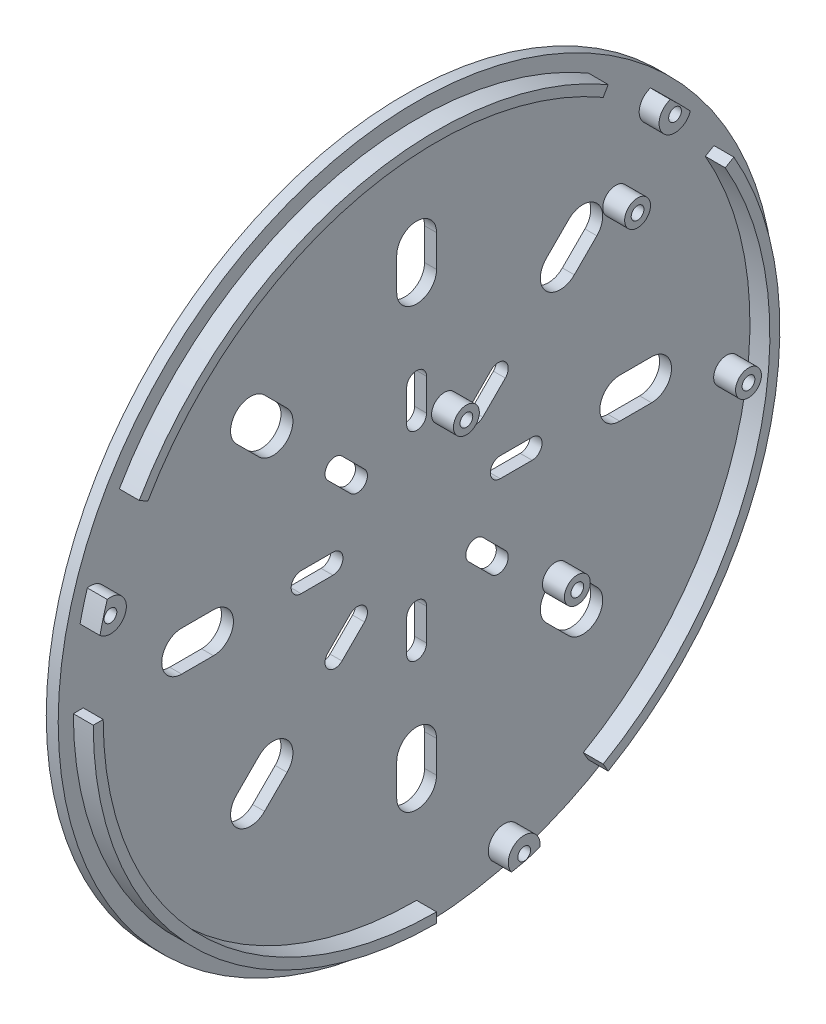
from build123d import *

# Parameters (mm, degrees)
SKETCH1_R               = 90
BOSS_EXTRUDE1_DEPTH     = 3
BOSS_EXTRUDE2_OUTLINE_R = 1.6
BOSS_EXTRUDE2_DEPTH     = 5
CUT_EXTRUDE1_DEPTH      = 128.377392174
CUT_EXTRUDE1_DEPTH_BACK = 128.377392174
SKETCH3_R               = 1.6
CUT_EXTRUDE2_DEPTH      = 128.530388683
CUT_EXTRUDE2_DEPTH_BACK = 2
SKETCH4_R               = 3.6
SKETCH4_R_2             = 1.6
BOSS_EXTRUDE3_DEPTH     = 5
SKETCH7_R               = 3.25
SKETCH7_R_2             = 1.6
BOSS_EXTRUDE4_DEPTH     = 5.5


# Read off the part's stored shape, not the designer's step: Boss-Extrude2
with BuildPart() as part:
    # Sketch1 → Boss-Extrude1 (new body)
    with BuildSketch(Plane(origin=(0, 0, 0), x_dir=(0, 0, -1), z_dir=(1, 0, 0))):
        Circle(SKETCH1_R)
        with BuildLine():
            Line((5, -51), (5, -59))
            ThreePointArc((5, -59), (0, -64), (-5, -59))
            Line((-5, -59), (-5, -51))
            ThreePointArc((-5, -51), (0, -46), (5, -51))
        make_face(mode=Mode.SUBTRACT)
        with BuildLine():
            Line((2.5, -21), (2.5, -29))
            ThreePointArc((2.5, -29), (0, -31.5), (-2.5, -29))
            Line((-2.5, -29), (-2.5, -21))
            ThreePointArc((-2.5, -21), (0, -18.5), (2.5, -21))
        make_face(mode=Mode.SUBTRACT)
        with BuildLine():
            Line((-32.526911935, -39.597979746), (-38.183766184, -45.254833996))
            ThreePointArc((-38.183766184, -45.254833996), (-45.254833996, -45.254833996), (-45.254833996, -38.183766184))
            Line((-45.254833996, -38.183766184), (-39.597979746, -32.526911935))
            ThreePointArc((-39.597979746, -32.526911935), (-32.526911935, -32.526911935), (-32.526911935, -39.597979746))
        make_face(mode=Mode.SUBTRACT)
        with BuildLine():
            Line((-13.081475452, -16.617009358), (-18.738329701, -22.273863607))
            ThreePointArc((-18.738329701, -22.273863607), (-22.273863607, -22.273863607), (-22.273863607, -18.738329701))
            Line((-22.273863607, -18.738329701), (-16.617009358, -13.081475452))
            ThreePointArc((-16.617009358, -13.081475452), (-13.081475452, -13.081475452), (-13.081475452, -16.617009358))
        make_face(mode=Mode.SUBTRACT)
        with BuildLine():
            Line((-51, -5), (-59, -5))
            ThreePointArc((-59, -5), (-64, 0), (-59, 5))
            Line((-59, 5), (-51, 5))
            ThreePointArc((-51, 5), (-46, 0), (-51, -5))
        make_face(mode=Mode.SUBTRACT)
        with BuildLine():
            Line((-21, -2.5), (-29, -2.5))
            ThreePointArc((-29, -2.5), (-31.5, 0), (-29, 2.5))
            Line((-29, 2.5), (-21, 2.5))
            ThreePointArc((-21, 2.5), (-18.5, 0), (-21, -2.5))
        make_face(mode=Mode.SUBTRACT)
        with BuildLine():
            Line((-39.597979746, 32.526911935), (-45.254833996, 38.183766184))
            ThreePointArc((-45.254833996, 38.183766184), (-45.254833996, 45.254833996), (-38.183766184, 45.254833996))
            Line((-38.183766184, 45.254833996), (-32.526911935, 39.597979746))
            ThreePointArc((-32.526911935, 39.597979746), (-32.526911935, 32.526911935), (-39.597979746, 32.526911935))
        make_face(mode=Mode.SUBTRACT)
        with BuildLine():
            Line((-16.617009358, 13.081475452), (-22.273863607, 18.738329701))
            ThreePointArc((-22.273863607, 18.738329701), (-22.273863607, 22.273863607), (-18.738329701, 22.273863607))
            Line((-18.738329701, 22.273863607), (-13.081475452, 16.617009358))
            ThreePointArc((-13.081475452, 16.617009358), (-13.081475452, 13.081475452), (-16.617009358, 13.081475452))
        make_face(mode=Mode.SUBTRACT)
        with BuildLine():
            Line((-5, 51), (-5, 59))
            ThreePointArc((-5, 59), (0, 64), (5, 59))
            Line((5, 59), (5, 51))
            ThreePointArc((5, 51), (0, 46), (-5, 51))
        make_face(mode=Mode.SUBTRACT)
        with BuildLine():
            Line((-2.5, 21), (-2.5, 29))
            ThreePointArc((-2.5, 29), (0, 31.5), (2.5, 29))
            Line((2.5, 29), (2.5, 21))
            ThreePointArc((2.5, 21), (0, 18.5), (-2.5, 21))
        make_face(mode=Mode.SUBTRACT)
        with BuildLine():
            Line((32.526911935, 39.597979746), (38.183766184, 45.254833996))
            ThreePointArc((38.183766184, 45.254833996), (45.254833996, 45.254833996), (45.254833996, 38.183766184))
            Line((45.254833996, 38.183766184), (39.597979746, 32.526911935))
            ThreePointArc((39.597979746, 32.526911935), (32.526911935, 32.526911935), (32.526911935, 39.597979746))
        make_face(mode=Mode.SUBTRACT)
        with BuildLine():
            Line((13.081475452, 16.617009358), (18.738329701, 22.273863607))
            ThreePointArc((18.738329701, 22.273863607), (22.273863607, 22.273863607), (22.273863607, 18.738329701))
            Line((22.273863607, 18.738329701), (16.617009358, 13.081475452))
            ThreePointArc((16.617009358, 13.081475452), (13.081475452, 13.081475452), (13.081475452, 16.617009358))
        make_face(mode=Mode.SUBTRACT)
        with BuildLine():
            Line((51, 5), (59, 5))
            ThreePointArc((59, 5), (64, 0), (59, -5))
            Line((59, -5), (51, -5))
            ThreePointArc((51, -5), (46, 0), (51, 5))
        make_face(mode=Mode.SUBTRACT)
        with BuildLine():
            Line((21, 2.5), (29, 2.5))
            ThreePointArc((29, 2.5), (31.5, 0), (29, -2.5))
            Line((29, -2.5), (21, -2.5))
            ThreePointArc((21, -2.5), (18.5, 0), (21, 2.5))
        make_face(mode=Mode.SUBTRACT)
        with BuildLine():
            Line((39.597979746, -32.526911935), (45.254833996, -38.183766184))
            ThreePointArc((45.254833996, -38.183766184), (45.254833996, -45.254833996), (38.183766184, -45.254833996))
            Line((38.183766184, -45.254833996), (32.526911935, -39.597979746))
            ThreePointArc((32.526911935, -39.597979746), (32.526911935, -32.526911935), (39.597979746, -32.526911935))
        make_face(mode=Mode.SUBTRACT)
        with BuildLine():
            Line((16.617009358, -13.081475452), (22.273863607, -18.738329701))
            ThreePointArc((22.273863607, -18.738329701), (22.273863607, -22.273863607), (18.738329701, -22.273863607))
            Line((18.738329701, -22.273863607), (13.081475452, -16.617009358))
            ThreePointArc((13.081475452, -16.617009358), (13.081475452, -13.081475452), (16.617009358, -13.081475452))
        make_face(mode=Mode.SUBTRACT)
    extrude(amount=BOSS_EXTRUDE1_DEPTH)

    # Boss-Extrude2 outline → Boss-Extrude2 (add)
    # profile 1 of 6: a face of its own
    with BuildSketch(Plane(origin=(3, 0, 0), x_dir=(0, 0, -1), z_dir=(1, 0, 0))):
        with BuildLine():
            ThreePointArc((25.967237713, -82.562734121), (20.964096527, -78.188292965), (18.820512309, -84.478937117))
            add(Edge.make_bspline(
                [(18.820512309, -84.478937117), (22.486577272, -83.865832246), (25.967237713, -82.562734121)],
                knots=[0, 0, 0, 1, 1, 1], degree=2))
        make_face()
        with Locations((22, -82.051828133)):
            Circle(BOSS_EXTRUDE2_OUTLINE_R, mode=Mode.SUBTRACT)
    # profile 2 of 6: a face of its own
    with BuildSketch(Plane(origin=(3, 0, 0), x_dir=(0, 0, -1), z_dir=(1, 0, 0))):
        with BuildLine():
            ThreePointArc((58.709779231, 63.592958122), (57.048561164, 56.942066762), (63.702544859, 58.590854905))
            ThreePointArc((63.702544859, 58.590854905), (61.257240645, 61.142889763), (58.709779231, 63.592958122))
        make_face()
        with Locations((59.879629478, 59.767850228)):
            Circle(BOSS_EXTRUDE2_OUTLINE_R, mode=Mode.SUBTRACT)
    # profile 3 of 6: a face of its own
    with BuildSketch(Plane(origin=(3, 0, 0), x_dir=(0, 0, -1), z_dir=(1, 0, 0))):
        with BuildLine():
            ThreePointArc((-82.683160515, 25.581193623), (-83.671189992, 22.136722102), (-84.515793874, 18.654304753))
            ThreePointArc((-84.515793874, 18.654304753), (-78.012676735, 20.639660383), (-82.683160515, 25.581193623))
        make_face()
        with Locations((-81.879629478, 21.662732462)):
            Circle(BOSS_EXTRUDE2_OUTLINE_R, mode=Mode.SUBTRACT)
    # profile 4 of 6: a face of its own
    with BuildSketch(Plane(origin=(3, 0, 0), x_dir=(0, 0, -1), z_dir=(1, 0, 0))):
        with BuildLine():
            Line((0, -86.2), (0, -83.7))
            ThreePointArc((0, -83.7), (-59.184837585, -59.184837585), (-83.7, 0))
            Line((-83.7, 0), (-86.2, 0))
            ThreePointArc((-86.2, 0), (-60.952604538, -60.952604538), (0, -86.2))
        make_face()
    # profile 5 of 6: a face of its own
    with BuildSketch(Plane(origin=(3, 0, 0), x_dir=(0, 0, -1), z_dir=(1, 0, 0))):
        with BuildLine():
            Line((-74.651389806, 43.1), (-72.486326297, 41.85))
            ThreePointArc((-72.486326297, 41.85), (-21.663154075, 80.84799166), (41.85, 72.486326297))
            Line((41.85, 72.486326297), (43.1, 74.651389806))
            ThreePointArc((43.1, 74.651389806), (-22.310201688, 83.262806226), (-74.651389806, 43.1))
        make_face()
    # profile 6 of 6: a face of its own
    with BuildSketch(Plane(origin=(3, 0, 0), x_dir=(0, 0, -1), z_dir=(1, 0, 0))):
        with BuildLine():
            Line((74.651389806, 43.1), (72.486326297, 41.85))
            ThreePointArc((72.486326297, 41.85), (80.84799166, -21.663154075), (41.85, -72.486326297))
            Line((41.85, -72.486326297), (43.1, -74.651389806))
            ThreePointArc((43.1, -74.651389806), (83.262806226, -22.310201688), (74.651389806, 43.1))
        make_face()
    extrude(amount=BOSS_EXTRUDE2_DEPTH)

    # Sketch3 → Cut-Extrude1 (cut, two sides: drawn at the far end of the back side and taken through both)
    with BuildSketch(Plane(origin=(3, 0, 0), x_dir=(0, 0, -1), z_dir=(1, 0, 0)).offset(-CUT_EXTRUDE1_DEPTH_BACK)):
        with Locations((22, -82.051828133)):
            Circle(SKETCH3_R)
        with Locations((59.879629478, 59.767850228)):
            Circle(SKETCH3_R)
        with Locations((-81.879629478, 21.662732462)):
            Circle(SKETCH3_R)
    extrude(amount=CUT_EXTRUDE1_DEPTH + CUT_EXTRUDE1_DEPTH_BACK, mode=Mode.SUBTRACT)

    # Sketch4 → Cut-Extrude2 (cut, two sides: drawn at the far end of the back side and taken through both)
    # profile 1 of 3: a face of its own
    with BuildSketch(Plane.ZY.offset(-CUT_EXTRUDE2_DEPTH_BACK)):
        with Locations(Location((81.879629478, 21.662732462, 0), (0, 0, 180))):
            Circle(SKETCH4_R)
        with Locations((81.879629478, 21.662732462)):
            Circle(SKETCH4_R_2, mode=Mode.SUBTRACT)
    # profile 2 of 3: a face of its own
    with BuildSketch(Plane.ZY.offset(-CUT_EXTRUDE2_DEPTH_BACK)):
        with Locations(Location((-22, -82.051828133, 0), (0, 0, 180))):
            Circle(SKETCH4_R)
        with Locations((-22, -82.051828133)):
            Circle(SKETCH4_R_2, mode=Mode.SUBTRACT)
    # profile 3 of 3: a face of its own
    with BuildSketch(Plane.ZY.offset(-CUT_EXTRUDE2_DEPTH_BACK)):
        with Locations(Location((-59.879629478, 59.767850228, 0), (0, 0, 180))):
            Circle(SKETCH4_R)
        with Locations((-59.879629478, 59.767850228)):
            Circle(SKETCH4_R_2, mode=Mode.SUBTRACT)
    extrude(amount=CUT_EXTRUDE2_DEPTH + CUT_EXTRUDE2_DEPTH_BACK, mode=Mode.SUBTRACT)

    # Sketch6 → Boss-Extrude3 (add)
    with BuildSketch(Plane.ZY):
        with BuildLine():
            Line((0, -73.891812808), (0, -75.894663844))
            ThreePointArc((0, -75.894663844), (1.247011194, -78.796568844), (4.210526316, -79.889119836))
            ThreePointArc((4.210526316, -79.889119836), (20.705523608, -77.274066103), (36.298137165, -71.291270422))
            ThreePointArc((36.298137165, -71.291270422), (38.31834105, -68.863335947), (37.947331922, -65.726706901))
            Line((37.947331922, -65.726706901), (36.945906404, -63.992187023))
            ThreePointArc((36.945906404, -63.992187023), (34.621165111, -62.157886819), (31.671977503, -62.425041779))
            ThreePointArc((31.671977503, -62.425041779), (18.117333157, -67.61480784), (3.783783784, -69.897660764))
            ThreePointArc((3.783783784, -69.897660764), (1.096134915, -71.140891586), (0, -73.891812808))
        make_face()
        with BuildLine():
            Line((-73.891812808, 0), (-75.894663844, 0))
            ThreePointArc((-75.894663844, 0), (-78.796568844, -1.247011194), (-79.889119836, -4.210526316))
            ThreePointArc((-79.889119836, -4.210526316), (-77.274066103, -20.705523608), (-71.291270422, -36.298137165))
            ThreePointArc((-71.291270422, -36.298137165), (-68.863335947, -38.31834105), (-65.726706901, -37.947331922))
            Line((-65.726706901, -37.947331922), (-63.992187023, -36.945906404))
            ThreePointArc((-63.992187023, -36.945906404), (-62.157886819, -34.621165111), (-62.425041779, -31.671977503))
            ThreePointArc((-62.425041779, -31.671977503), (-67.61480784, -18.117333157), (-69.897660764, -3.783783784))
            ThreePointArc((-69.897660764, -3.783783784), (-71.140891586, -1.096134915), (-73.891812808, 0))
        make_face()
        with BuildLine():
            Line((0, 73.891812808), (0, 75.894663844))
            ThreePointArc((0, 75.894663844), (-1.247011194, 78.796568844), (-4.210526316, 79.889119836))
            ThreePointArc((-4.210526316, 79.889119836), (-20.705523608, 77.274066103), (-36.298137165, 71.291270422))
            ThreePointArc((-36.298137165, 71.291270422), (-38.31834105, 68.863335947), (-37.947331922, 65.726706901))
            Line((-37.947331922, 65.726706901), (-36.945906404, 63.992187023))
            ThreePointArc((-36.945906404, 63.992187023), (-34.621165111, 62.157886819), (-31.671977503, 62.425041779))
            ThreePointArc((-31.671977503, 62.425041779), (-18.117333157, 67.61480784), (-3.783783784, 69.897660764))
            ThreePointArc((-3.783783784, 69.897660764), (-1.096134915, 71.140891586), (0, 73.891812808))
        make_face()
        with BuildLine():
            Line((73.891812808, 0), (75.894663844, 0))
            ThreePointArc((75.894663844, 0), (78.796568844, 1.247011194), (79.889119836, 4.210526316))
            ThreePointArc((79.889119836, 4.210526316), (77.274066103, 20.705523608), (71.291270422, 36.298137165))
            ThreePointArc((71.291270422, 36.298137165), (68.863335947, 38.31834105), (65.726706901, 37.947331922))
            Line((65.726706901, 37.947331922), (63.992187023, 36.945906404))
            ThreePointArc((63.992187023, 36.945906404), (62.157886819, 34.621165111), (62.425041779, 31.671977503))
            ThreePointArc((62.425041779, 31.671977503), (67.61480784, 18.117333157), (69.897660764, 3.783783784))
            ThreePointArc((69.897660764, 3.783783784), (71.140891586, 1.096134915), (73.891812808, 0))
        make_face()
    extrude(amount=BOSS_EXTRUDE3_DEPTH)

    # Sketch7 → Boss-Extrude4 (add)
    # profile 1 of 4: a face of its own
    with BuildSketch(Plane(origin=(3, 0, 0), x_dir=(0, 0, -1), z_dir=(1, 0, 0))):
        with Locations((49.977286002, 43.548517586)):
            Circle(SKETCH7_R)
        with Locations((49.977286002, 43.548517586)):
            Circle(SKETCH7_R_2, mode=Mode.SUBTRACT)
    # profile 2 of 4: a face of its own
    with BuildSketch(Plane(origin=(3, 0, 0), x_dir=(0, 0, -1), z_dir=(1, 0, 0))):
        with Locations((77.828793765, -7.32675652)):
            Circle(SKETCH7_R)
        with Locations((77.828793765, -7.32675652)):
            Circle(SKETCH7_R_2, mode=Mode.SUBTRACT)
    # profile 3 of 4: a face of its own
    with BuildSketch(Plane(origin=(3, 0, 0), x_dir=(0, 0, -1), z_dir=(1, 0, 0))):
        with Locations(Location((34.847958745, -30.856478596, 0), (0, 0, 217.143329019))):
            Circle(SKETCH7_R)
        with Locations(Location((34.847958745, -30.856478596, 0), (0, 0, 214.155517653))):
            Circle(SKETCH7_R_2, mode=Mode.SUBTRACT)
    # profile 4 of 4: a face of its own
    with BuildSketch(Plane(origin=(3, 0, 0), x_dir=(0, 0, -1), z_dir=(1, 0, 0))):
        with Locations((6.996450981, 20.01879551)):
            Circle(SKETCH7_R)
        with Locations((6.996450981, 20.01879551)):
            Circle(SKETCH7_R_2, mode=Mode.SUBTRACT)
    extrude(amount=BOSS_EXTRUDE4_DEPTH)


solid = part.part
